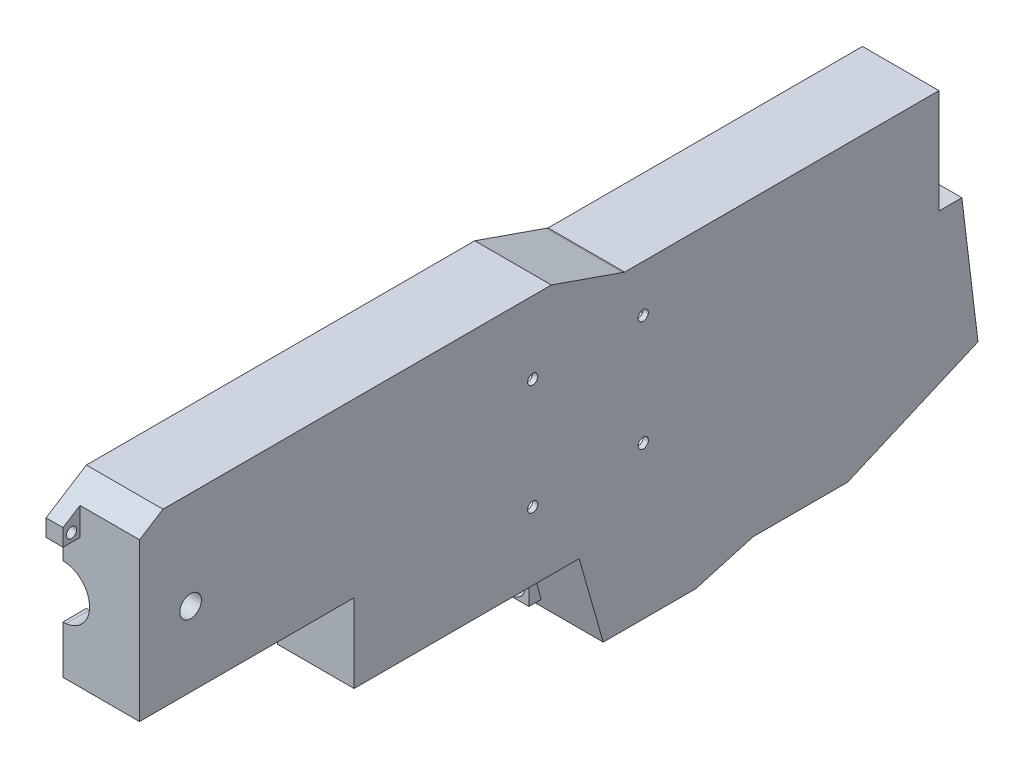
from build123d import *

# Parameters (mm, degrees)
SKETCH_1_W                   = 200
SKETCH_1_H                   = 65
SKETCH_1_R                   = 2.55
SKETCH_1_R_2                 = 2.2
EXTRUDE_1_DEPTH              = 2
SKETCH_2_W                   = 200
SKETCH_2_H                   = 2
EXTRUDE_2_DEPTH              = 16
SKETCH_3_R                   = 2.55
EXTRUDE_3_DEPTH              = 2.6
SKETCH_4_R                   = 4
SKETCH_4_R_2                 = 2.55
EXTRUDE_4_DEPTH              = 4.5
SKETCH_5_R                   = 2.2
EXTRUDE_5_DEPTH              = 16
SKETCH_6_R                   = 3.75
EXTRUDE_6_DEPTH              = 8.2
SKETCH_7_W                   = 200
SKETCH_7_H                   = 2
EXTRUDE_7_DEPTH              = 2
SKETCH_8_W                   = 165.45
SKETCH_8_H                   = 1.65
EXTRUDE_8_DEPTH              = 1.5
EXTRUDE_10_REACH             = 108.629
SKETCH_9_W                   = 5.5
SKETCH_9_H                   = 4
SKETCH_9_H_2                 = 4.5
SKETCH_9_H_3                 = 2
EXTRUDE_10_DIRECTION_2_REACH = 108.629
SKETCH_10_W                  = 5.5
SKETCH_10_H                  = 6.2
CUT_EXTRUDE_1_DEPTH          = 6.24
EXTRUDE_11_DEPTH             = 5.5
CUT_EXTRUDE_2_DEPTH          = 107.987148761
SKETCH_13_W                  = 2
SKETCH_13_H                  = 19
EXTRUDE_12_DEPTH             = 16
SKETCH_15_W                  = 11
SKETCH_15_H                  = 2
CUT_EXTRUDE_3_DEPTH          = 6.3
SKETCH_16_W                  = 7
SKETCH_16_H                  = 2
CUT_EXTRUDE_4_DEPTH          = 14
EXTRUDE_13_DEPTH             = 2
SKETCH_18_W                  = 14
SKETCH_18_H                  = 2
CUT_EXTRUDE_5_DEPTH          = 16
CUT_EXTRUDE_6_DEPTH          = 2
EXTRUDE_START                = -18
SKETCH_20_R                  = 25.5
SKETCH_20_R_2                = 22.7
EXTRUDE_14_DEPTH             = 24
SKETCH_21_W                  = 13
SKETCH_21_H                  = 4.7
EXTRUDE_15_DEPTH             = 2
SKETCH_22_R                  = 1.25
CUT_EXTRUDE_7_DEPTH          = 2
EXTRUDE_START_2              = 2
SKETCH_23_R                  = 22.7
SKETCH_23_R_2                = 1.25
EXTRUDE_17_DEPTH             = 2
CUT_EXTRUDE_START            = -16
CUT_EXTRUDE_10_DEPTH         = 16
CUT_EXTRUDE_START_2          = -17
CUT_EXTRUDE_10_2_OUTLINE_R   = 2.45
CUT_EXTRUDE_10_2_OUTLINE_R_2 = 1.25
CUT_EXTRUDE_10_2_DEPTH       = 1
EXTRUDE_START_3              = -1.5
EXTRUDE_18_DEPTH             = 1.5
SKETCH_28_W                  = 4
SKETCH_28_H                  = 4
SKETCH_28_R                  = 1.2
EXTRUDE_20_DEPTH             = 4
SKETCH_29_W                  = 4
SKETCH_29_H                  = 4
SKETCH_29_R                  = 1.2
EXTRUDE_21_DEPTH             = 4
EXTRUDE_22_DEPTH             = 4
SKETCH_31_W                  = 4
SKETCH_31_H                  = 4
SKETCH_31_R                  = 1.2
EXTRUDE_23_DEPTH             = 4
CUT_EXTRUDE_START_3          = -6
SKETCH_32_R                  = 25.5
CUT_EXTRUDE_11_DEPTH         = 6
CUT_EXTRUDE_12_DEPTH         = 16
SKETCH_35_W                  = 5.5
SKETCH_35_H                  = 3
SKETCH_35_W_2                = 2
SKETCH_35_H_2                = 2
EXTRUDE_26_DEPTH             = 16
EXTRUDE_START_4              = -2
EXTRUDE_30_DEPTH             = 2
SKETCH_38_W                  = 16
SKETCH_38_H                  = 5.5
EXTRUDE_31_DEPTH             = 6.3
CUT_EXTRUDE_START_4          = 5
CUT_EXTRUDE_13_DEPTH         = 5
CUT_EXTRUDE_START_5          = -5
CUT_EXTRUDE_14_DEPTH         = 5
CUT_EXTRUDE_15_DEPTH         = 9.7
SKETCH_42_W                  = 14
SKETCH_42_H                  = 2
CUT_EXTRUDE_17_DEPTH         = 12
EXTRUDE_35_DEPTH             = 18
EXTRUDE_36_DEPTH             = 2
CUT_EXTRUDE_18_DEPTH         = 2
EXTRUDE_37_REACH             = 114.296
SKETCH_47_W                  = 91.33315603
SKETCH_47_H                  = 4
EXTRUDE_38_DEPTH             = 2
SKETCH_48_W                  = 91.33315603
SKETCH_48_H                  = 2
CUT_EXTRUDE_19_DEPTH         = 16
CUT_EXTRUDE_20_DEPTH         = 14
CUT_EXTRUDE_21_DEPTH         = 16
SKETCH_51_R                  = 3.75
SKETCH_51_R_2                = 2.2
EXTRUDE_39_DEPTH             = 8.2
SKETCH_53_R                  = 2.1
EXTRUDE_40_DEPTH             = 7.8
SKETCH_54_R                  = 3.75
CUT_EXTRUDE_23_DEPTH         = 16
SKETCH_55_R                  = 2.2
EXTRUDE_42_DEPTH             = 2
EXTRUDE_43_DEPTH             = 4
SKETCH_57_W                  = 9
SKETCH_57_H                  = 2
EXTRUDE_44_DEPTH             = 12
SKETCH_58_W                  = 6
SKETCH_58_H                  = 2
CUT_EXTRUDE_24_DEPTH         = 12
CUT_EXTRUDE_START_6          = -4.5
SKETCH_59_R                  = 4
CUT_EXTRUDE_25_DEPTH         = 4.5
CUT_EXTRUDE_26_REACH         = 115.05
SKETCH_60_W                  = 12
SKETCH_60_H                  = 24.5
SKETCH_60_W_2                = 4
SKETCH_60_H_2                = 4
SKETCH_60_R                  = 1.2
SKETCH_61_W                  = 2
SKETCH_61_H                  = 28
CUT_EXTRUDE_27_DEPTH         = 114.049767802
EXTRUDE_45_DEPTH             = 18
CUT_EXTRUDE_28_DEPTH         = 10
SKETCH_64_R                  = 1.2
EXTRUDE_46_DEPTH             = 4
SKETCH_65_W                  = 5
SKETCH_65_H                  = 6.638569711
EXTRUDE_47_DEPTH             = 4
CUT_EXTRUDE_29_DEPTH         = 10
EXTRUDE_48_DEPTH             = 12
EXTRUDE_49_DEPTH             = 1.5
SKETCH_70_R                  = 2.45
EXTRUDE_50_DEPTH             = 2
EXTRUDE_51_DEPTH             = 5.1
EXTRUDE_START_5              = -4
EXTRUDE_51_2_OUTLINE_R       = 3.2
EXTRUDE_51_2_DEPTH           = 2.8
EXTRUDE_START_6              = -1.2
EXTRUDE_51_3_OUTLINE_R       = 1.2
EXTRUDE_51_3_DEPTH           = 2.2


with BuildPart() as part:
    # 草图1 → 凸台-拉伸1 (new body)
    with BuildSketch(Plane(origin=(0, 0, 0), x_dir=(0, 0, -1), z_dir=(1, 0, 0))):
        Rectangle(SKETCH_1_W, SKETCH_1_H)
        with Locations((-88, 17.5)):
            Circle(SKETCH_1_R, mode=Mode.SUBTRACT)
        with Locations((61.45, -15.22)):
            Circle(SKETCH_1_R_2, mode=Mode.SUBTRACT)
    extrude(amount=EXTRUDE_1_DEPTH)

    # 草图3 → 凸台-拉伸3 (add)
    with BuildSketch(Plane(origin=(2, 0, 0), x_dir=(0, 0, -1), z_dir=(1, 0, 0))):
        Polygon((-65.45, 13.5), (-65.45, 17.5), (-65.45, 21.5), (-100, 21.5), (-100, 13.5), align=None)
        with Locations((-88, 17.5)):
            Circle(SKETCH_3_R, mode=Mode.SUBTRACT)
    extrude(amount=EXTRUDE_3_DEPTH)

    # 草图4 → 凸台-拉伸4 (add)
    with BuildSketch(Plane(origin=(4.6, 0, 0), x_dir=(0, 0, -1), z_dir=(1, 0, 0))):
        with Locations(Location((-88, 17.5, 0), (0, 0, 270))):
            Circle(SKETCH_4_R)
        with Locations((-88, 17.5)):
            Circle(SKETCH_4_R_2, mode=Mode.SUBTRACT)
    extrude(amount=EXTRUDE_4_DEPTH)



with BuildPart() as body_2:
    # 草图2 → 凸台-拉伸2 (new body)
    with BuildSketch(Plane(origin=(2, 0, 0), x_dir=(0, 0, -1), z_dir=(1, 0, 0))):
        with Locations((0, 33.5)):
            Rectangle(SKETCH_2_W, SKETCH_2_H)
    extrude(amount=EXTRUDE_2_DEPTH)


with BuildPart() as body_3:
    # 草图5 → 凸台-拉伸5 (new body)
    with BuildSketch(Plane(origin=(2, 0, 0), x_dir=(0, 0, -1), z_dir=(1, 0, 0))):
        with Locations((61.45, -15.22)):
            Circle(SKETCH_5_R)
    extrude(amount=EXTRUDE_5_DEPTH)


with BuildPart() as part_1:
    add(part.part)

    add(body_3.part)  # 凸台-拉伸6 merges body 3
    # 草图6 → 凸台-拉伸6 (add)
    with BuildSketch(Plane(origin=(2, 0, 0), x_dir=(0, 0, -1), z_dir=(1, 0, 0))):
        with Locations((61.45, -15.22)):
            Circle(SKETCH_6_R)
    extrude(amount=EXTRUDE_6_DEPTH)


    add(body_2.part)  # 凸台-拉伸7 merges body 2
    # 草图7 → 凸台-拉伸7 (add)
    with BuildSketch(Plane.ZY.offset(-2)):
        with Locations((0, 33.5)):
            Rectangle(SKETCH_7_W, SKETCH_7_H)
    extrude(amount=EXTRUDE_7_DEPTH)

    # 草图8 → 凸台-拉伸8 (add)
    with BuildSketch(Plane(origin=(2, 0, 0), x_dir=(0, 0, -1), z_dir=(1, 0, 0))):
        with Locations((17.275, 20.675)):
            Rectangle(SKETCH_8_W, SKETCH_8_H)
        with Locations((17.275, 14.325)):
            Rectangle(SKETCH_8_W, SKETCH_8_H)
    extrude(amount=EXTRUDE_8_DEPTH)

    # 凸台-拉伸10: up to this face of the body (flat: up to its plane)
    extrude_10_end = Plane(part_1.part.faces().sort_by_distance((18, 33.5, 0))[0])
    # 草图9 → 凸台-拉伸10 (add, up to the picked face)
    with BuildSketch(Plane(origin=(4.6, 0, 0), x_dir=(0, 0, -1), z_dir=(1, 0, 0)), mode=Mode.PRIVATE) as extrude_10_sk1:
        Polygon((-100, 21.5), (-94.5, 21.5), (-94.5, 32.5), (-100, 32.5), (-100, 28), align=None)
    extrude_10_tool1 = split(extrude(extrude_10_sk1.sketch, amount=EXTRUDE_10_REACH, mode=Mode.PRIVATE), bisect_by=extrude_10_end, keep=Keep.BOTH, mode=Mode.PRIVATE)
    # 草图9 → 凸台-拉伸10 (add, up to the picked face)
    with BuildSketch(Plane(origin=(4.6, 0, 0), x_dir=(0, 0, -1), z_dir=(1, 0, 0)), mode=Mode.PRIVATE) as extrude_10_sk2:
        with Locations((-97.25, 19.5)):
            Rectangle(SKETCH_9_W, SKETCH_9_H)
    extrude_10_tool2 = split(extrude(extrude_10_sk2.sketch, amount=EXTRUDE_10_REACH, mode=Mode.PRIVATE), bisect_by=extrude_10_end, keep=Keep.BOTH, mode=Mode.PRIVATE)
    # 草图9 → 凸台-拉伸10 (add, up to the picked face)
    with BuildSketch(Plane(origin=(4.6, 0, 0), x_dir=(0, 0, -1), z_dir=(1, 0, 0)), mode=Mode.PRIVATE) as extrude_10_sk3:
        with Locations((-97.25, 15.5)):
            Rectangle(SKETCH_9_W, SKETCH_9_H)
    extrude_10_tool3 = split(extrude(extrude_10_sk3.sketch, amount=EXTRUDE_10_REACH, mode=Mode.PRIVATE), bisect_by=extrude_10_end, keep=Keep.BOTH, mode=Mode.PRIVATE)
    # 草图9 → 凸台-拉伸10 (add, up to the picked face)
    with BuildSketch(Plane(origin=(4.6, 0, 0), x_dir=(0, 0, -1), z_dir=(1, 0, 0)), mode=Mode.PRIVATE) as extrude_10_sk4:
        with Locations((-97.25, 9.25)):
            Rectangle(SKETCH_9_W, SKETCH_9_H_2)
    extrude_10_tool4 = split(extrude(extrude_10_sk4.sketch, amount=EXTRUDE_10_REACH, mode=Mode.PRIVATE), bisect_by=extrude_10_end, keep=Keep.BOTH, mode=Mode.PRIVATE)
    # 草图9 → 凸台-拉伸10 (add, up to the picked face)
    with BuildSketch(Plane(origin=(4.6, 0, 0), x_dir=(0, 0, -1), z_dir=(1, 0, 0)), mode=Mode.PRIVATE) as extrude_10_sk5:
        with Locations((-97.25, 12.5)):
            Rectangle(SKETCH_9_W, SKETCH_9_H_3)
    extrude_10_tool5 = split(extrude(extrude_10_sk5.sketch, amount=EXTRUDE_10_REACH, mode=Mode.PRIVATE), bisect_by=extrude_10_end, keep=Keep.BOTH, mode=Mode.PRIVATE)
    add(extrude_10_tool1.solids().sort_by(Axis((4.6, 27, 97.25), (1, 0, 0)))[0])
    add(extrude_10_tool2.solids().sort_by(Axis((4.6, 19.5, 97.25), (1, 0, 0)))[0])
    add(extrude_10_tool3.solids().sort_by(Axis((4.6, 15.5, 97.25), (1, 0, 0)))[0])
    add(extrude_10_tool4.solids().sort_by(Axis((4.6, 9.25, 97.25), (1, 0, 0)))[0])
    add(extrude_10_tool5.solids().sort_by(Axis((4.6, 12.5, 97.25), (1, 0, 0)))[0])

    # 凸台-拉伸10 direction 2: up to this face of the body (flat: up to its plane)
    extrude_10_direction_2_end = Plane(part_1.part.faces().sort_by_distance((2, -9.47239987, 0.296508389))[0])
    # 草图9 → 凸台-拉伸10 direction 2 (add, up to the picked face)
    with BuildSketch(Plane(origin=(4.6, 0, 0), x_dir=(0, 0, -1), z_dir=(1, 0, 0)), mode=Mode.PRIVATE) as extrude_10_direction_2_sk1:
        Polygon((-100, 21.5), (-94.5, 21.5), (-94.5, 32.5), (-100, 32.5), (-100, 28), align=None)
    extrude_10_direction_2_tool1 = split(extrude(extrude_10_direction_2_sk1.sketch, amount=-EXTRUDE_10_DIRECTION_2_REACH, mode=Mode.PRIVATE), bisect_by=extrude_10_direction_2_end, keep=Keep.BOTH, mode=Mode.PRIVATE)
    # 草图9 → 凸台-拉伸10 direction 2 (add, up to the picked face)
    with BuildSketch(Plane(origin=(4.6, 0, 0), x_dir=(0, 0, -1), z_dir=(1, 0, 0)), mode=Mode.PRIVATE) as extrude_10_direction_2_sk2:
        with Locations((-97.25, 19.5)):
            Rectangle(SKETCH_9_W, SKETCH_9_H)
    extrude_10_direction_2_tool2 = split(extrude(extrude_10_direction_2_sk2.sketch, amount=-EXTRUDE_10_DIRECTION_2_REACH, mode=Mode.PRIVATE), bisect_by=extrude_10_direction_2_end, keep=Keep.BOTH, mode=Mode.PRIVATE)
    # 草图9 → 凸台-拉伸10 direction 2 (add, up to the picked face)
    with BuildSketch(Plane(origin=(4.6, 0, 0), x_dir=(0, 0, -1), z_dir=(1, 0, 0)), mode=Mode.PRIVATE) as extrude_10_direction_2_sk3:
        with Locations((-97.25, 15.5)):
            Rectangle(SKETCH_9_W, SKETCH_9_H)
    extrude_10_direction_2_tool3 = split(extrude(extrude_10_direction_2_sk3.sketch, amount=-EXTRUDE_10_DIRECTION_2_REACH, mode=Mode.PRIVATE), bisect_by=extrude_10_direction_2_end, keep=Keep.BOTH, mode=Mode.PRIVATE)
    # 草图9 → 凸台-拉伸10 direction 2 (add, up to the picked face)
    with BuildSketch(Plane(origin=(4.6, 0, 0), x_dir=(0, 0, -1), z_dir=(1, 0, 0)), mode=Mode.PRIVATE) as extrude_10_direction_2_sk4:
        with Locations((-97.25, 9.25)):
            Rectangle(SKETCH_9_W, SKETCH_9_H_2)
    extrude_10_direction_2_tool4 = split(extrude(extrude_10_direction_2_sk4.sketch, amount=-EXTRUDE_10_DIRECTION_2_REACH, mode=Mode.PRIVATE), bisect_by=extrude_10_direction_2_end, keep=Keep.BOTH, mode=Mode.PRIVATE)
    # 草图9 → 凸台-拉伸10 direction 2 (add, up to the picked face)
    with BuildSketch(Plane(origin=(4.6, 0, 0), x_dir=(0, 0, -1), z_dir=(1, 0, 0)), mode=Mode.PRIVATE) as extrude_10_direction_2_sk5:
        with Locations((-97.25, 12.5)):
            Rectangle(SKETCH_9_W, SKETCH_9_H_3)
    extrude_10_direction_2_tool5 = split(extrude(extrude_10_direction_2_sk5.sketch, amount=-EXTRUDE_10_DIRECTION_2_REACH, mode=Mode.PRIVATE), bisect_by=extrude_10_direction_2_end, keep=Keep.BOTH, mode=Mode.PRIVATE)
    add(extrude_10_direction_2_tool1.solids().sort_by(Axis((4.6, 27, 97.25), (-1, 0, 0)))[0])
    add(extrude_10_direction_2_tool2.solids().sort_by(Axis((4.6, 19.5, 97.25), (-1, 0, 0)))[0])
    add(extrude_10_direction_2_tool3.solids().sort_by(Axis((4.6, 15.5, 97.25), (-1, 0, 0)))[0])
    add(extrude_10_direction_2_tool4.solids().sort_by(Axis((4.6, 9.25, 97.25), (-1, 0, 0)))[0])
    add(extrude_10_direction_2_tool5.solids().sort_by(Axis((4.6, 12.5, 97.25), (-1, 0, 0)))[0])

    # 草图10 → 切除-拉伸1 (cut)
    with BuildSketch(Plane(origin=(18, 0, 0), x_dir=(0, 0, -1), z_dir=(1, 0, 0))):
        with Locations((-97.25, 20.6)):
            Rectangle(SKETCH_10_W, SKETCH_10_H)
        with Locations((-97.25, 14.4)):
            Rectangle(SKETCH_10_W, SKETCH_10_H)
    extrude(amount=-CUT_EXTRUDE_1_DEPTH, mode=Mode.SUBTRACT)

    # 草图11 → 凸台-拉伸11 (add)
    with BuildSketch(Plane.XY.offset(100)):
        with BuildLine():
            ThreePointArc((11.76, 17.5), (13.344930508, 21.655469652), (17.294592316, 23.7))
            Line((17.294592316, 23.7), (11.76, 23.7))
            Line((11.76, 23.7), (11.76, 17.5))
        make_face()
        with BuildLine():
            Line((11.76, 11.3), (17.294592316, 11.3))
            ThreePointArc((17.294592316, 11.3), (13.344930508, 13.344530348), (11.76, 17.5))
            Line((11.76, 17.5), (11.76, 11.3))
        make_face()
    extrude(amount=-EXTRUDE_11_DEPTH)

    # 草图12 → 切除-拉伸2 (cut, through all)
    with BuildSketch(Plane(origin=(2, 0, 0), x_dir=(0, 0, -1), z_dir=(1, 0, 0))):
        Polygon((-100, -32.5), (5.45, -32.5), (5.45, -15.22), (5.45, -13.5), (-44.55, -13.5), (-44.55, 5), (-94.5, 5), (-100, 5), align=None)
    extrude(amount=-CUT_EXTRUDE_2_DEPTH, mode=Mode.SUBTRACT)

    # 草图13 → 凸台-拉伸12 (add)
    with BuildSketch(Plane(origin=(2, 0, 0), x_dir=(0, 0, -1), z_dir=(1, 0, 0))):
        Polygon((-42.55, 7), (-92.5, 7), (-94.5, 7), (-100, 7), (-100, 5), (-44.55, 5), (-44.55, -13.5), (5.45, -13.5), (5.45, -32.5), (100, -32.5), (100, 13.5), (98, 13.5), (98, 11.5), (98, -30.5), (7.45, -30.5), (7.45, -11.5), (-42.55, -11.5), align=None)
        with Locations((99, 23)):
            Rectangle(SKETCH_13_W, SKETCH_13_H)
    extrude(amount=EXTRUDE_12_DEPTH)

    # 草图15 → 切除-拉伸3 (cut)
    with BuildSketch(Plane(origin=(18, 0, 0), x_dir=(0, 0, -1), z_dir=(1, 0, 0))):
        with Locations((-12.05, -12.5)):
            Rectangle(SKETCH_15_W, SKETCH_15_H)
    extrude(amount=-CUT_EXTRUDE_3_DEPTH, mode=Mode.SUBTRACT)

    # 草图16 → 切除-拉伸4 (cut)
    with BuildSketch(Plane(origin=(18, 0, 0), x_dir=(0, 0, -1), z_dir=(1, 0, 0))):
        with Locations((-78.5, 6)):
            Rectangle(SKETCH_16_W, SKETCH_16_H)
        with Locations((-71.5, 6)):
            Rectangle(SKETCH_16_W, SKETCH_16_H)
    extrude(amount=-CUT_EXTRUDE_4_DEPTH, mode=Mode.SUBTRACT)

    # 草图17 → 凸台-拉伸13 (add)
    with BuildSketch(Plane.XZ.offset(-5)):
        with BuildLine():
            ThreePointArc((18, 68), (11, 75), (18, 82))
            Line((18, 82), (4, 82))
            Line((4, 82), (4, 68))
            Line((4, 68), (18, 68))
        make_face()
    extrude(amount=-EXTRUDE_13_DEPTH)

    # 草图18 → 切除-拉伸5 (cut)
    with BuildSketch(Plane(origin=(18, 0, 0), x_dir=(0, 0, -1), z_dir=(1, 0, 0))):
        with Locations((91, -31.5)):
            Rectangle(SKETCH_18_W, SKETCH_18_H)
    extrude(amount=-CUT_EXTRUDE_5_DEPTH, mode=Mode.SUBTRACT)

    # 草图19 → 切除-拉伸6 (cut)
    with BuildSketch(Plane(origin=(2, 0, 0), x_dir=(0, 0, -1), z_dir=(1, 0, 0))):
        Polygon((-2.8, 19.85), (-2.8, 17.5), (-2.8, 15.15), (10.2, 15.15), (10.2, 19.85), align=None)
    extrude(amount=-CUT_EXTRUDE_6_DEPTH, mode=Mode.SUBTRACT)

    # 草图20 → 凸台-拉伸14 (add)
    with BuildSketch(Plane.ZY.offset(EXTRUDE_START)):
        with Locations((-5.45, 10.5)):
            Circle(SKETCH_20_R)
        with Locations((-5.45, 10.5)):
            Circle(SKETCH_20_R_2, mode=Mode.SUBTRACT)
    extrude(amount=EXTRUDE_14_DEPTH)

    # 草图21 → 凸台-拉伸15 (add)
    with BuildSketch(Plane.ZY):
        with Locations((-3.7, 17.5)):
            Rectangle(SKETCH_21_W, SKETCH_21_H)
    extrude(amount=-EXTRUDE_15_DEPTH)

    # 草图22 → 切除-拉伸7 (cut)
    with BuildSketch(Plane.ZY):
        with Locations((-5.45, 3)):
            Circle(SKETCH_22_R)
        with Locations((-12.167514421, 3.782485579)):
            Circle(SKETCH_22_R)
        with Locations((-12.95, 10.5)):
            Circle(SKETCH_22_R)
        with Locations((-12.167514421, 17.217514421)):
            Circle(SKETCH_22_R)
        with Locations((-5.45, 18)):
            Circle(SKETCH_22_R)
        with Locations((1.267514421, 17.217514421)):
            Circle(SKETCH_22_R)
        with Locations((2.05, 10.5)):
            Circle(SKETCH_22_R)
        with Locations((1.267514421, 3.782485579)):
            Circle(SKETCH_22_R)
    extrude(amount=-CUT_EXTRUDE_7_DEPTH, mode=Mode.SUBTRACT)

    # 草图23 → 凸台-拉伸17 (add)
    with BuildSketch(Plane.ZY.offset(EXTRUDE_START_2)):
        with Locations((-5.45, 10.5)):
            Circle(SKETCH_23_R)
        with Locations((1.267514421, 3.782485579)):
            Circle(SKETCH_23_R_2, mode=Mode.SUBTRACT)
        with Locations((2.05, 10.5)):
            Circle(SKETCH_23_R_2, mode=Mode.SUBTRACT)
        with Locations((1.267514421, 17.217514421)):
            Circle(SKETCH_23_R_2, mode=Mode.SUBTRACT)
        with Locations((-5.45, 18)):
            Circle(SKETCH_23_R_2, mode=Mode.SUBTRACT)
        with Locations((-12.167514421, 17.217514421)):
            Circle(SKETCH_23_R_2, mode=Mode.SUBTRACT)
        with Locations((-12.95, 10.5)):
            Circle(SKETCH_23_R_2, mode=Mode.SUBTRACT)
        with Locations((-12.167514421, 3.782485579)):
            Circle(SKETCH_23_R_2, mode=Mode.SUBTRACT)
        with Locations((-5.45, 3)):
            Circle(SKETCH_23_R_2, mode=Mode.SUBTRACT)
    extrude(amount=-EXTRUDE_17_DEPTH)

    # 切除-拉伸10: read off the stored shape, not the designer's step
    # 切除-拉伸10 outline → 切除-拉伸10 (cut)
    with BuildSketch(Plane(origin=(18, 0, 0), x_dir=(0, 0, -1), z_dir=(1, 0, 0)).offset(CUT_EXTRUDE_START)):
        with BuildLine():
            Line((7.45, -12.111722623), (7.45, -14.921447638))
            ThreePointArc((7.45, -14.921447638), (25.162434806, -5.676214453), (30.772914524, 13.5))
            ThreePointArc((30.772914524, 13.5), (30.66118187, 14.327049613), (30.522445034, 15.15))
            ThreePointArc((30.522445034, 15.15), (29.961128378, 17.532395439), (29.173985752, 19.85))
            ThreePointArc((29.173985752, 19.85), (28.829270645, 20.681340978), (28.455434141, 21.5))
            ThreePointArc((28.455434141, 21.5), (24.22335075, 27.757210134), (18.343796958, 32.5))
            Line((18.343796958, 32.5), (11.043746508, 32.5))
            ThreePointArc((11.043746508, 32.5), (19.312964197, 28.475211367), (25.306736892, 21.5))
            ThreePointArc((25.306736892, 21.5), (25.737628923, 20.683423426), (26.134958303, 19.85))
            ThreePointArc((26.134958303, 19.85), (27.030128894, 17.54187737), (27.66862957, 15.15))
            ThreePointArc((27.66862957, 15.15), (27.824973909, 14.327602719), (27.950888871, 13.5))
            ThreePointArc((27.950888871, 13.5), (23.171836045, -3.685433627), (7.45, -12.111722623))
        make_face()
        with BuildLine():
            Line((-7.443796958, -11.5), (-0.143746508, -11.5))
            ThreePointArc((-0.143746508, -11.5), (-13.353646834, -2.216637359), (-17.050888871, 13.5))
            ThreePointArc((-17.050888871, 13.5), (-16.924973909, 14.327602719), (-16.768629571, 15.15))
            ThreePointArc((-16.768629571, 15.15), (-16.130128895, 17.54187737), (-15.234958303, 19.85))
            ThreePointArc((-15.234958303, 19.85), (-14.837628923, 20.683423426), (-14.406736892, 21.5))
            ThreePointArc((-14.406736892, 21.5), (-8.412964197, 28.475211367), (-0.143746508, 32.5))
            Line((-0.143746508, 32.5), (-7.443796958, 32.5))
            ThreePointArc((-7.443796958, 32.5), (-13.32335075, 27.757210134), (-17.555434141, 21.5))
            ThreePointArc((-17.555434141, 21.5), (-17.929270645, 20.681340978), (-18.273985753, 19.85))
            ThreePointArc((-18.273985753, 19.85), (-19.061128378, 17.532395439), (-19.622445034, 15.15))
            ThreePointArc((-19.622445034, 15.15), (-19.76118187, 14.327049613), (-19.872914524, 13.5))
            ThreePointArc((-19.872914524, 13.5), (-17.383730732, -0.852124949), (-7.443796958, -11.5))
        make_face()
        with BuildLine():
            ThreePointArc((10.853024361, 15.15), (12.167514421, 14.767514421), (13.482004481, 15.15))
            Line((13.482004481, 15.15), (10.853024361, 15.15))
        make_face()
        with BuildLine():
            Line((0.046975639, 15.15), (-2.582004481, 15.15))
            ThreePointArc((-2.582004481, 15.15), (-1.267514421, 14.767514421), (0.046975639, 15.15))
        make_face()
        with BuildLine():
            Line((3.84376216, 19.85), (7.05623784, 19.85))
            ThreePointArc((7.05623784, 19.85), (5.45, 20.45), (3.84376216, 19.85))
        make_face()
    extrude(amount=CUT_EXTRUDE_10_DEPTH, mode=Mode.SUBTRACT)

    # Cut-Extrude 10 2 outline → Cut-Extrude 10 2 (cut)
    # profile 1 of 8: a face of its own
    with BuildSketch(Plane(origin=(18, 0, 0), x_dir=(0, 0, -1), z_dir=(1, 0, 0)).offset(CUT_EXTRUDE_START_2)):
        with Locations((12.167514421, 17.217514421)):
            Circle(CUT_EXTRUDE_10_2_OUTLINE_R)
        with Locations((12.167514421, 17.217514421)):
            Circle(CUT_EXTRUDE_10_2_OUTLINE_R_2, mode=Mode.SUBTRACT)
    # profile 2 of 8: a face of its own
    with BuildSketch(Plane(origin=(18, 0, 0), x_dir=(0, 0, -1), z_dir=(1, 0, 0)).offset(CUT_EXTRUDE_START_2)):
        with Locations((-1.267514421, 17.217514421)):
            Circle(CUT_EXTRUDE_10_2_OUTLINE_R)
        with Locations((-1.267514421, 17.217514421)):
            Circle(CUT_EXTRUDE_10_2_OUTLINE_R_2, mode=Mode.SUBTRACT)
    # profile 3 of 8: a face of its own
    with BuildSketch(Plane(origin=(18, 0, 0), x_dir=(0, 0, -1), z_dir=(1, 0, 0)).offset(CUT_EXTRUDE_START_2)):
        with Locations((5.45, 18)):
            Circle(CUT_EXTRUDE_10_2_OUTLINE_R)
        with Locations((5.45, 18)):
            Circle(CUT_EXTRUDE_10_2_OUTLINE_R_2, mode=Mode.SUBTRACT)
    # profile 4 of 8: a face of its own
    with BuildSketch(Plane(origin=(18, 0, 0), x_dir=(0, 0, -1), z_dir=(1, 0, 0)).offset(CUT_EXTRUDE_START_2)):
        with Locations((-1.267514421, 3.782485579)):
            Circle(CUT_EXTRUDE_10_2_OUTLINE_R)
        with Locations((-1.267514421, 3.782485579)):
            Circle(CUT_EXTRUDE_10_2_OUTLINE_R_2, mode=Mode.SUBTRACT)
    # profile 5 of 8: a face of its own
    with BuildSketch(Plane(origin=(18, 0, 0), x_dir=(0, 0, -1), z_dir=(1, 0, 0)).offset(CUT_EXTRUDE_START_2)):
        with Locations((-2.05, 10.5)):
            Circle(CUT_EXTRUDE_10_2_OUTLINE_R)
        with Locations((-2.05, 10.5)):
            Circle(CUT_EXTRUDE_10_2_OUTLINE_R_2, mode=Mode.SUBTRACT)
    # profile 6 of 8: a face of its own
    with BuildSketch(Plane(origin=(18, 0, 0), x_dir=(0, 0, -1), z_dir=(1, 0, 0)).offset(CUT_EXTRUDE_START_2)):
        with Locations((12.95, 10.5)):
            Circle(CUT_EXTRUDE_10_2_OUTLINE_R)
        with Locations((12.95, 10.5)):
            Circle(CUT_EXTRUDE_10_2_OUTLINE_R_2, mode=Mode.SUBTRACT)
    # profile 7 of 8: a face of its own
    with BuildSketch(Plane(origin=(18, 0, 0), x_dir=(0, 0, -1), z_dir=(1, 0, 0)).offset(CUT_EXTRUDE_START_2)):
        with Locations((12.167514421, 3.782485579)):
            Circle(CUT_EXTRUDE_10_2_OUTLINE_R)
        with Locations((12.167514421, 3.782485579)):
            Circle(CUT_EXTRUDE_10_2_OUTLINE_R_2, mode=Mode.SUBTRACT)
    # profile 8 of 8: a face of its own
    with BuildSketch(Plane(origin=(18, 0, 0), x_dir=(0, 0, -1), z_dir=(1, 0, 0)).offset(CUT_EXTRUDE_START_2)):
        with Locations((5.45, 3)):
            Circle(CUT_EXTRUDE_10_2_OUTLINE_R)
        with Locations((5.45, 3)):
            Circle(CUT_EXTRUDE_10_2_OUTLINE_R_2, mode=Mode.SUBTRACT)
    extrude(amount=CUT_EXTRUDE_10_2_DEPTH, mode=Mode.SUBTRACT)

    # 草图26 → 凸台-拉伸18 (add)
    with BuildSketch(Plane(origin=(3.5, 0, 0), x_dir=(0, 0, -1), z_dir=(1, 0, 0)).offset(EXTRUDE_START_3)):
        with BuildLine():
            ThreePointArc((-14.406736892, 21.5), (-14.837628923, 20.683423426), (-15.234958303, 19.85))
            Line((-15.234958303, 19.85), (-18.273985753, 19.85))
            ThreePointArc((-18.273985753, 19.85), (-17.929270645, 20.681340978), (-17.555434141, 21.5))
            Line((-17.555434141, 21.5), (-14.406736892, 21.5))
        make_face()
        with BuildLine():
            ThreePointArc((-16.768629571, 15.15), (-16.924973909, 14.327602719), (-17.050888871, 13.5))
            Line((-17.050888871, 13.5), (-19.872914524, 13.5))
            ThreePointArc((-19.872914524, 13.5), (-19.76118187, 14.327049613), (-19.622445034, 15.15))
            Line((-19.622445034, 15.15), (-16.768629571, 15.15))
        make_face()
        with BuildLine():
            ThreePointArc((26.134958303, 19.85), (25.737628923, 20.683423426), (25.306736892, 21.5))
            Line((25.306736892, 21.5), (28.455434141, 21.5))
            ThreePointArc((28.455434141, 21.5), (28.829270645, 20.681340978), (29.173985753, 19.85))
            Line((29.173985753, 19.85), (26.134958303, 19.85))
        make_face()
        with BuildLine():
            Line((30.772914524, 13.5), (27.950888871, 13.5))
            ThreePointArc((27.950888871, 13.5), (27.824973909, 14.327602719), (27.668629571, 15.15))
            Line((27.668629571, 15.15), (30.522445034, 15.15))
            ThreePointArc((30.522445034, 15.15), (30.66118187, 14.327049613), (30.772914524, 13.5))
        make_face()
    extrude(amount=EXTRUDE_18_DEPTH)

    # 草图28 → 凸台-拉伸20 (add)
    with BuildSketch(Plane(origin=(18, 0, 0), x_dir=(0, 0, -1), z_dir=(1, 0, 0))):
        with Locations((102, 32.5)):
            Rectangle(SKETCH_28_W, SKETCH_28_H)
        with Locations((102, 32.5)):
            Circle(SKETCH_28_R, mode=Mode.SUBTRACT)
    extrude(amount=-EXTRUDE_20_DEPTH)

    # 草图29 → 凸台-拉伸21 (add)
    with BuildSketch(Plane(origin=(18, 0, 0), x_dir=(0, 0, -1), z_dir=(1, 0, 0))):
        with Locations((102, -30.5)):
            Rectangle(SKETCH_29_W, SKETCH_29_H)
        with Locations((102, -30.5)):
            Circle(SKETCH_29_R, mode=Mode.SUBTRACT)
    extrude(amount=-EXTRUDE_21_DEPTH)

    # 草图30 → 凸台-拉伸22 (add)
    with BuildSketch(Plane(origin=(18, 0, 0), x_dir=(0, 0, -1), z_dir=(1, 0, 0))):
        with BuildLine():
            Line((2.058047025, -16.447242322), (0.45, -15))
            Line((0.45, -15), (0.45, -19.5))
            Line((0.45, -19.5), (5.45, -19.5))
            Line((5.45, -19.5), (3.841952975, -18.052757678))
            ThreePointArc((3.841952975, -18.052757678), (2.147242322, -18.141952975), (2.058047025, -16.447242322))
        make_face()
        with BuildLine():
            Line((5.45, -15), (0.45, -15))
            Line((0.45, -15), (2.058047025, -16.447242322))
            ThreePointArc((2.058047025, -16.447242322), (3.379916521, -16.129655506), (4.15, -17.25))
            ThreePointArc((4.15, -17.25), (4.070344494, -17.679916521), (3.841952975, -18.052757678))
            Line((3.841952975, -18.052757678), (5.45, -19.5))
            Line((5.45, -19.5), (5.45, -15))
        make_face()
        with BuildLine():
            Line((0.45, -19.5), (0.45, -15))
            Line((0.45, -15), (5.45, -15))
            ThreePointArc((5.45, -15), (1.076786079, -14.622201337), (-3.16684397, -13.5))
            Line((-3.16684397, -13.5), (-3.16684397, -19.5))
            Line((-3.16684397, -19.5), (0.45, -19.5))
        make_face()
    extrude(amount=-EXTRUDE_22_DEPTH)

    # 草图31 → 凸台-拉伸23 (add)
    with BuildSketch(Plane(origin=(18, 0, 0), x_dir=(0, 0, -1), z_dir=(1, 0, 0))):
        with Locations((-102, 32.5)):
            Rectangle(SKETCH_31_W, SKETCH_31_H)
        with Locations((-102, 32.5)):
            Circle(SKETCH_31_R, mode=Mode.SUBTRACT)
    extrude(amount=-EXTRUDE_23_DEPTH)

    # 草图32 → 切除-拉伸11 (cut)
    with BuildSketch(Plane.ZY.offset(6).offset(CUT_EXTRUDE_START_3)):
        with Locations((-5.45, 10.5)):
            Circle(SKETCH_32_R)
    extrude(amount=CUT_EXTRUDE_11_DEPTH, mode=Mode.SUBTRACT)

    # 草图34 → 切除-拉伸12 (cut)
    with BuildSketch(Plane(origin=(18, 0, 0), x_dir=(0, 0, -1), z_dir=(1, 0, 0))):
        Polygon((-68, 7), (-68, 5), (-44.55, 5), (-44.55, -13.5), (-17.55, -13.5), (-17.55, -11.5), (-42.55, -11.5), (-42.55, 7), align=None)
        Polygon((-100, 5), (-82, 5), (-82, 7), (-94.5, 7), (-94.5, 11.3), (-100, 11.3), align=None)
        with BuildLine():
            Line((-3.16684397, -19.5), (5.45, -19.5))
            Line((5.45, -19.5), (5.45, -32.5))
            Line((5.45, -32.5), (84, -32.5))
            Line((84, -32.5), (84, -30.5))
            Line((84, -30.5), (7.45, -30.5))
            Line((7.45, -30.5), (7.45, -11.5))
            Line((7.45, -11.5), (-7.443796958, -11.5))
            ThreePointArc((-7.443796958, -11.5), (-6.999408892, -11.754487598), (-6.55, -12))
            Line((-6.55, -12), (-6.55, -13.5))
            Line((-6.55, -13.5), (-3.16684397, -13.5))
            Line((-3.16684397, -13.5), (-3.16684397, -19.5))
        make_face()
    extrude(amount=-CUT_EXTRUDE_12_DEPTH, mode=Mode.SUBTRACT)



with BuildPart() as body_2_2:
    # 草图35 → 凸台-拉伸26 (new body)
    with BuildSketch(Plane(origin=(2, 0, 0), x_dir=(0, 0, -1), z_dir=(1, 0, 0))):
        Polygon((-49.55, 2), (-94.5, 2), (-100, 2), (-100, 0), (-49.55, 0), align=None)
        with Locations((-97.25, 3.5)):
            Rectangle(SKETCH_35_W, SKETCH_35_H)
        with Locations((-48.55, 1)):
            Rectangle(SKETCH_35_W_2, SKETCH_35_H_2)
        Polygon((-47.55, 0), (-49.55, 0), (-49.55, -13.5), (-49.55, -18.5), (-44.55, -18.5), (5.45, -18.5), (5.45, -16.5), (-44.55, -16.5), (-47.55, -16.5), (-47.55, -13.5), align=None)
    extrude(amount=EXTRUDE_26_DEPTH)


with BuildPart() as part_2:
    add(part_1.part)

    add(body_2_2.part)  # 凸台-拉伸30 merges body 2 2
    # 草图37 → 凸台-拉伸30 (add)
    with BuildSketch(Plane.ZY.offset(EXTRUDE_START_4)):
        with BuildLine():
            Line((-5.45, -15), (-5.45, -16.5))
            Line((-5.45, -16.5), (47.55, -16.5))
            Line((47.55, -16.5), (47.55, 2))
            Line((47.55, 2), (94.5, 2))
            Line((94.5, 2), (94.5, 5))
            Line((94.5, 5), (44.55, 5))
            Line((44.55, 5), (44.55, -13.5))
            Line((44.55, -13.5), (3.16684397, -13.5))
            ThreePointArc((3.16684397, -13.5), (-1.076786079, -14.622201337), (-5.45, -15))
        make_face()
        Polygon((-5.45, -16.5), (-5.45, -18.5), (49.55, -18.5), (49.55, 0), (100, 0), (100, 5), (94.5, 5), (94.5, 2), (47.55, 2), (47.55, -16.5), align=None)
    extrude(amount=EXTRUDE_30_DEPTH)

    # 草图38 → 凸台-拉伸31 (add)
    with BuildSketch(Plane(origin=(0, 5, 0), x_dir=(1, 0, 0), z_dir=(0, 1, 0))):
        with Locations((10, -97.25)):
            Rectangle(SKETCH_38_W, SKETCH_38_H)
    extrude(amount=EXTRUDE_31_DEPTH)

    # 草图39 → 切除-拉伸13 (cut)
    with BuildSketch(Plane.XZ.offset(-5).offset(CUT_EXTRUDE_START_4)):
        with BuildLine():
            Line((18, 82), (18, 68))
            ThreePointArc((18, 68), (11, 75), (18, 82))
        make_face()
    extrude(amount=-CUT_EXTRUDE_13_DEPTH, mode=Mode.SUBTRACT)

    # 草图40 → 切除-拉伸14 (cut)
    with BuildSketch(Plane(origin=(0, 7, 0), x_dir=(1, 0, 0), z_dir=(0, 1, 0)).offset(CUT_EXTRUDE_START_5)):
        with BuildLine():
            Line((2, -82), (18, -82))
            ThreePointArc((18, -82), (11, -75), (18, -68))
            Line((18, -68), (2, -68))
            Line((2, -68), (2, -82))
        make_face()
    extrude(amount=CUT_EXTRUDE_14_DEPTH, mode=Mode.SUBTRACT)

    # 草图41 → 切除-拉伸15 (cut)
    with BuildSketch(Plane(origin=(11.7, 0, 0), x_dir=(0, 0, -1), z_dir=(1, 0, 0))):
        with BuildLine():
            Line((-7.443796958, -11.5), (-17.55, -11.5))
            Line((-17.55, -11.5), (-17.55, -13.5))
            Line((-17.55, -13.5), (-6.55, -13.5))
            Line((-6.55, -13.5), (-6.55, -12))
            ThreePointArc((-6.55, -12), (-6.999408892, -11.754487598), (-7.443796958, -11.5))
        make_face()
    extrude(amount=-CUT_EXTRUDE_15_DEPTH, mode=Mode.SUBTRACT)

    # 草图42 → 切除-拉伸17 (cut)
    with BuildSketch(Plane(origin=(18, 0, 0), x_dir=(0, 0, -1), z_dir=(1, 0, 0))):
        with Locations((-22.05, -17.5)):
            Rectangle(SKETCH_42_W, SKETCH_42_H)
    extrude(amount=-CUT_EXTRUDE_17_DEPTH, mode=Mode.SUBTRACT)

    # 草图43 → 凸台-拉伸35 (add)
    with BuildSketch(Plane(origin=(2, 0, 0), x_dir=(0, 0, -1), z_dir=(1, 0, 0)).offset(EXTRUDE_START_4)):
        Polygon((5.45, -18.5), (3.369968603, -18.5), (9.040281686, -38.346095791), (30.828994401, -38.346095791), (44.290329668, -34.5), (100, -34.5), (100, -32.5), (44.010219779, -32.5), (30.548884512, -36.346095791), (10.548884512, -36.346095791), align=None)
    extrude(amount=EXTRUDE_35_DEPTH)

    # 草图44 → 凸台-拉伸36 (add)
    with BuildSketch(Plane(origin=(2, 0, 0), x_dir=(0, 0, -1), z_dir=(1, 0, 0))):
        Polygon((44.010219779, -32.5), (9.45, -32.5), (10.548884512, -36.346095791), (30.548884512, -36.346095791), align=None)
    extrude(amount=-EXTRUDE_36_DEPTH)

    # 草图45 → 切除-拉伸18 (cut)
    with BuildSketch(Plane(origin=(2, 0, 0), x_dir=(0, 0, -1), z_dir=(1, 0, 0))):
        Polygon((7.369968603, -32.5), (5.45, -25.780109889), (5.45, -32.5), align=None)
    extrude(amount=-CUT_EXTRUDE_18_DEPTH, mode=Mode.SUBTRACT)

    # 凸台-拉伸37: up to this face of the body (flat: up to its plane)
    extrude_37_end = Plane(part_2.part.faces().sort_by_distance((0, 4.411657354, -13.61181875))[0])
    # 草图46 → 凸台-拉伸37 (add, up to the picked face)
    with BuildSketch(Plane(origin=(18, 0, 0), x_dir=(0, 0, -1), z_dir=(1, 0, 0)), mode=Mode.PRIVATE) as extrude_37_sk1:
        with BuildLine():
            Line((-104, 34.5), (-94.5, 34.5))
            Line((-94.5, 34.5), (-94.5, 38.5))
            Line((-94.5, 38.5), (-3.16684397, 38.5))
            Line((-3.16684397, 38.5), (-3.16684397, 34.5))
            ThreePointArc((-3.16684397, 34.5), (5.203401519, 35.998807603), (13.60106862, 34.662162162))
            Line((13.60106862, 34.662162162), (-3.16684397, 40.5))
            Line((-3.16684397, 40.5), (-94.5, 40.5))
            Line((-94.5, 40.5), (-104, 34.5))
        make_face()
    extrude_37_tool1 = split(extrude(extrude_37_sk1.sketch, amount=-EXTRUDE_37_REACH, mode=Mode.PRIVATE), bisect_by=extrude_37_end, keep=Keep.BOTH, mode=Mode.PRIVATE)
    add(extrude_37_tool1.solids().sort_by(Axis((18, 38.830648, 47.50919), (-1, 0, 0)))[0])

    # 草图47 → 凸台-拉伸38 (add)
    with BuildSketch(Plane.ZY):
        with Locations((48.833421985, 36.5)):
            Rectangle(SKETCH_47_W, SKETCH_47_H)
    extrude(amount=-EXTRUDE_38_DEPTH)

    # 草图48 → 切除-拉伸19 (cut)
    with BuildSketch(Plane(origin=(18, 0, 0), x_dir=(0, 0, -1), z_dir=(1, 0, 0))):
        with Locations((-48.833421985, 33.5)):
            Rectangle(SKETCH_48_W, SKETCH_48_H)
    extrude(amount=-CUT_EXTRUDE_19_DEPTH, mode=Mode.SUBTRACT)

    # 草图49 → 切除-拉伸20 (cut)
    with BuildSketch(Plane.ZY):
        Polygon((100, 37.026315789), (100, 34.5), (104, 34.5), align=None)
    extrude(amount=-CUT_EXTRUDE_20_DEPTH, mode=Mode.SUBTRACT)

    # 草图50 → 切除-拉伸21 (cut)
    with BuildSketch(Plane(origin=(18, 0, 0), x_dir=(0, 0, -1), z_dir=(1, 0, 0))):
        Polygon((14.06684397, 32.5), (-3.16684397, 38.5), (-3.16684397, 32.5), align=None)
    extrude(amount=-CUT_EXTRUDE_21_DEPTH, mode=Mode.SUBTRACT)

    # 草图51 → 凸台-拉伸39 (add)
    # profile 1 of 2: a face of its own
    with BuildSketch(Plane(origin=(2, 0, 0), x_dir=(0, 0, -1), z_dir=(1, 0, 0))):
        with Locations((61.45, -23.22)):
            Circle(SKETCH_51_R)
        with Locations((61.45, -23.22)):
            Circle(SKETCH_51_R_2, mode=Mode.SUBTRACT)
    # profile 2 of 2: a face of its own
    with BuildSketch(Plane(origin=(2, 0, 0), x_dir=(0, 0, -1), z_dir=(1, 0, 0))):
        with Locations((61.45, -23.22)):
            Circle(SKETCH_51_R_2)
    extrude(amount=EXTRUDE_39_DEPTH)

    # 草图53 → 凸台-拉伸40 (add)
    with BuildSketch(Plane(origin=(10.2, 0, 0), x_dir=(0, 0, -1), z_dir=(1, 0, 0))):
        with Locations((61.45, -23.22)):
            Circle(SKETCH_53_R)
    extrude(amount=EXTRUDE_40_DEPTH)

    # 草图54 → 切除-拉伸23 (cut)
    with BuildSketch(Plane(origin=(18, 0, 0), x_dir=(0, 0, -1), z_dir=(1, 0, 0)).offset(CUT_EXTRUDE_START)):
        with Locations((61.45, -15.22)):
            Circle(SKETCH_54_R)
    extrude(amount=CUT_EXTRUDE_23_DEPTH, mode=Mode.SUBTRACT)

    # 草图55 → 凸台-拉伸42 (add)
    with BuildSketch(Plane(origin=(2, 0, 0), x_dir=(0, 0, -1), z_dir=(1, 0, 0)).offset(EXTRUDE_START_4)):
        with Locations((61.45, -15.22)):
            Circle(SKETCH_55_R)
    extrude(amount=EXTRUDE_42_DEPTH)

    # 草图56 → 凸台-拉伸43 (add)
    with BuildSketch(Plane(origin=(18, 0, 0), x_dir=(0, 0, -1), z_dir=(1, 0, 0))):
        with BuildLine():
            Line((-0.790094191, -18.5), (0.352762952, -22.5))
            Line((0.352762952, -22.5), (1.138731162, -21.458018378))
            ThreePointArc((1.138731162, -21.458018378), (0.9033474, -19.777365384), (2.584000393, -19.541981622))
            Line((2.584000393, -19.541981622), (3.369968603, -18.5))
            Line((3.369968603, -18.5), (-0.790094191, -18.5))
        make_face()
        with BuildLine():
            Line((1.138731162, -21.458018378), (0.352762952, -22.5))
            Line((0.352762952, -22.5), (4.512825746, -22.5))
            Line((4.512825746, -22.5), (3.369968603, -18.5))
            Line((3.369968603, -18.5), (2.584000393, -19.541981622))
            ThreePointArc((2.584000393, -19.541981622), (2.935414552, -19.964818507), (3.061365778, -20.5))
            ThreePointArc((3.061365778, -20.5), (2.396547271, -21.574048774), (1.138731162, -21.458018378))
        make_face()
    extrude(amount=-EXTRUDE_43_DEPTH)

    # 草图57 → 凸台-拉伸44 (add)
    with BuildSketch(Plane(origin=(6, 0, 0), x_dir=(0, 0, -1), z_dir=(1, 0, 0))):
        with Locations((-24.55, -17.5)):
            Rectangle(SKETCH_57_W, SKETCH_57_H)
    extrude(amount=EXTRUDE_44_DEPTH)

    # 草图58 → 切除-拉伸24 (cut)
    with BuildSketch(Plane(origin=(18, 0, 0), x_dir=(0, 0, -1), z_dir=(1, 0, 0))):
        with Locations((-12.05, -17.5)):
            Rectangle(SKETCH_58_W, SKETCH_58_H)
    extrude(amount=-CUT_EXTRUDE_24_DEPTH, mode=Mode.SUBTRACT)

    # 草图59 → 切除-拉伸25 (cut)
    with BuildSketch(Plane(origin=(9.1, 0, 0), x_dir=(0, 0, -1), z_dir=(1, 0, 0)).offset(CUT_EXTRUDE_START_6)):
        with Locations((-88, 17.5)):
            Circle(SKETCH_59_R)
    extrude(amount=CUT_EXTRUDE_25_DEPTH, mode=Mode.SUBTRACT)

    # 切除-拉伸26: up to this face of the body (flat: up to its plane)
    cut_extrude_26_end = Plane(part_2.part.faces().sort_by_distance((0, 6.075509046, -10.530996935))[0])
    # 草图60 → 切除-拉伸26 (cut, up to the picked face)
    with BuildSketch(Plane(origin=(18, 0, 0), x_dir=(0, 0, -1), z_dir=(1, 0, 0)), mode=Mode.PRIVATE) as cut_extrude_26_sk1:
        with Locations((92, 20.25)):
            Rectangle(SKETCH_60_W, SKETCH_60_H)
    cut_extrude_26_tool1 = split(extrude(cut_extrude_26_sk1.sketch, amount=-CUT_EXTRUDE_26_REACH, mode=Mode.PRIVATE), bisect_by=cut_extrude_26_end, keep=Keep.BOTH, mode=Mode.PRIVATE)
    # 草图60 → 切除-拉伸26 (cut, up to the picked face)
    with BuildSketch(Plane(origin=(18, 0, 0), x_dir=(0, 0, -1), z_dir=(1, 0, 0)), mode=Mode.PRIVATE) as cut_extrude_26_sk2:
        Polygon((100, 30.5), (100, 34.5), (86, 34.5), (86, 32.5), (98, 32.5), (98, 8), (100, 8), align=None)
    cut_extrude_26_tool2 = split(extrude(cut_extrude_26_sk2.sketch, amount=-CUT_EXTRUDE_26_REACH, mode=Mode.PRIVATE), bisect_by=cut_extrude_26_end, keep=Keep.BOTH, mode=Mode.PRIVATE)
    # 草图60 → 切除-拉伸26 (cut, up to the picked face)
    with BuildSketch(Plane(origin=(18, 0, 0), x_dir=(0, 0, -1), z_dir=(1, 0, 0)), mode=Mode.PRIVATE) as cut_extrude_26_sk3:
        with Locations((102, 32.5)):
            Rectangle(SKETCH_60_W_2, SKETCH_60_H_2)
        with Locations((102, 32.5)):
            Circle(SKETCH_60_R, mode=Mode.SUBTRACT)
    cut_extrude_26_tool3 = split(extrude(cut_extrude_26_sk3.sketch, amount=-CUT_EXTRUDE_26_REACH, mode=Mode.PRIVATE), bisect_by=cut_extrude_26_end, keep=Keep.BOTH, mode=Mode.PRIVATE)
    # 草图60 → 切除-拉伸26 (cut, up to the picked face)
    with BuildSketch(Plane(origin=(18, 0, 0), x_dir=(0, 0, -1), z_dir=(1, 0, 0)), mode=Mode.PRIVATE) as cut_extrude_26_sk4:
        with Locations((102, 32.5)):
            Circle(SKETCH_60_R)
    cut_extrude_26_tool4 = split(extrude(cut_extrude_26_sk4.sketch, amount=-CUT_EXTRUDE_26_REACH, mode=Mode.PRIVATE), bisect_by=cut_extrude_26_end, keep=Keep.BOTH, mode=Mode.PRIVATE)
    add(cut_extrude_26_tool1.solids().sort_by(Axis((18, 20.25, -92), (-1, 0, 0)))[0], mode=Mode.SUBTRACT)
    add(cut_extrude_26_tool2.solids().sort_by(Axis((18, 19.25, -99.700292), (-1, 0, 0)))[0], mode=Mode.SUBTRACT)
    add(cut_extrude_26_tool3.solids().sort_by(Axis((18, 34.443431, -102), (-1, 0, 0)))[0], mode=Mode.SUBTRACT)
    add(cut_extrude_26_tool4.solids().sort_by(Axis((18, 32.5, -102), (-1, 0, 0)))[0], mode=Mode.SUBTRACT)

    # 草图61 → 切除-拉伸27 (cut, through all)
    with BuildSketch(Plane(origin=(18, 0, 0), x_dir=(0, 0, -1), z_dir=(1, 0, 0))):
        Polygon((98, 8), (91.6, 8), (95, -20), (98, -20), align=None)
        with Locations((99, -6)):
            Rectangle(SKETCH_61_W, SKETCH_61_H)
        Polygon((98, -20), (95, -20), (66.077586207, -32.5), (98, -32.5), align=None)
        Polygon((100, -20), (98, -20), (98, -32.5), (66.077586207, -32.5), (61.45, -34.5), (100, -34.5), (100, -32.5), (104, -32.5), (104, -28.5), (100, -28.5), align=None)
    extrude(amount=-CUT_EXTRUDE_27_DEPTH, mode=Mode.SUBTRACT)

    # 凸台-拉伸45: read off the stored shape, not the designer's step
    # 凸台-拉伸45 outline → 凸台-拉伸45 (add)
    with BuildSketch(Plane(origin=(2, 0, 0), x_dir=(0, 0, -1), z_dir=(1, 0, 0)).offset(EXTRUDE_START_4)):
        Polygon((66.077586207, -32.5), (61.45, -34.5), (66.491284965, -34.5), (97.165607383, -21.24284128), (93.371833799, 10), (88, 10), (88, 34.5), (86, 34.5), (86, 8), (91.6, 8), (95, -20), align=None)
    extrude(amount=EXTRUDE_45_DEPTH)

    # 草图63 → 切除-拉伸28 (cut)
    with BuildSketch(Plane(origin=(18, 0, 0), x_dir=(0, 0, -1), z_dir=(1, 0, 0))):
        Polygon((88.538793103, -22.79247392), (72.538793103, -29.70752608), (73.332241605, -31.543401751), (89.332241605, -24.62834959), align=None)
    extrude(amount=-CUT_EXTRUDE_28_DEPTH, mode=Mode.SUBTRACT)

    # 草图64 → 凸台-拉伸46 (add)
    with BuildSketch(Plane(origin=(18, 0, 0), x_dir=(0, 0, -1), z_dir=(1, 0, 0))):
        Polygon((88, 16), (88, 10), (93.371833799, 10), (91.6, 16), align=None)
        with Locations((89.8, 13)):
            Circle(SKETCH_64_R, mode=Mode.SUBTRACT)
    extrude(amount=-EXTRUDE_46_DEPTH)

    # 草图65 → 凸台-拉伸47 (add)
    with BuildSketch(Plane(origin=(18, 0, 0), x_dir=(0, 0, -1), z_dir=(1, 0, 0))):
        Polygon((5.548884512, -36.346095791), (8.468853115, -36.346095791), (6.572118912, -29.70752608), (5.548884512, -29.70752608), align=None)
        with Locations((13.048884512, -33.026810936)):
            Rectangle(SKETCH_65_W, SKETCH_65_H)
        Polygon((8.652150309, -29.70752608), (10.548884512, -36.346095791), (10.548884512, -29.70752608), align=None)
    extrude(amount=-EXTRUDE_47_DEPTH)

    # 草图66 → 切除-拉伸29 (cut)
    with BuildSketch(Plane.XY.offset(-5.548884512)):
        with BuildLine():
            ThreePointArc((18, -29.976810936), (14.95, -33.026810936), (18, -36.076810936))
            Line((18, -36.076810936), (18, -29.976810936))
        make_face()
        with BuildLine():
            Line((18, -29.976810936), (18, -36.076810936))
            ThreePointArc((18, -36.076810936), (20.156675683, -35.183486618), (21.05, -33.026810936))
            ThreePointArc((21.05, -33.026810936), (20.156675683, -30.870135253), (18, -29.976810936))
        make_face()
    extrude(amount=-CUT_EXTRUDE_29_DEPTH, mode=Mode.SUBTRACT)

    # 草图67 → 凸台-拉伸48 (add)
    with BuildSketch(Plane(origin=(2, 0, 0), x_dir=(0, 0, -1), z_dir=(1, 0, 0))):
        Polygon((8.729088839, -29.976810936), (15.548884512, -29.976810936), (15.548884512, -29.70752608), (8.652150309, -29.70752608), align=None)
        Polygon((15.548884512, -36.076810936), (15.548884512, -29.976810936), (8.729088839, -29.976810936), (10.471945982, -36.076810936), align=None)
        Polygon((15.548884512, -36.346095791), (15.548884512, -36.076810936), (10.471945982, -36.076810936), (10.548884512, -36.346095791), align=None)
    extrude(amount=EXTRUDE_48_DEPTH)


with BuildPart() as body_2_3:
    # 镜向1: mirrored copy
    add(part_2.part.mirror(Plane(origin=(0, 0, 0), x_dir=(0, 0, 1), z_dir=(1, 0, 0))))

    # 草图69 → 凸台-拉伸49 (add)
    with BuildSketch(Plane.ZY.offset(3.5).offset(EXTRUDE_START_3)):
        with BuildLine():
            Line((-7.05623784, 19.85), (-3.84376216, 19.85))
            ThreePointArc((-3.84376216, 19.85), (-5.45, 20.45), (-7.05623784, 19.85))
        make_face()
        with BuildLine():
            Line((-13.482004481, 15.15), (-10.853024361, 15.15))
            ThreePointArc((-10.853024361, 15.15), (-12.167514421, 14.767514421), (-13.482004481, 15.15))
        make_face()
        with BuildLine():
            Line((-0.046975639, 15.15), (2.582004481, 15.15))
            ThreePointArc((2.582004481, 15.15), (1.267514421, 14.767514421), (-0.046975639, 15.15))
        make_face()
    extrude(amount=EXTRUDE_49_DEPTH)

    # 草图70 → 凸台-拉伸50 (add)
    with BuildSketch(Plane.ZY.offset(2)):
        with BuildLine():
            ThreePointArc((-9.717514421, 17.217514421), (-13.346920915, 19.364954833), (-13.482004481, 15.15))
            ThreePointArc((-13.482004481, 15.15), (-12.167514421, 14.767514421), (-10.853024361, 15.15))
            ThreePointArc((-10.853024361, 15.15), (-10.020074009, 16.038107928), (-9.717514421, 17.217514421))
        make_face()
        with BuildLine():
            ThreePointArc((-3.84376216, 19.85), (-5.45, 20.45), (-7.05623784, 19.85))
            ThreePointArc((-7.05623784, 19.85), (-6.466665454, 15.770898981), (-3, 18))
            ThreePointArc((-3, 18), (-3.220898981, 19.016665454), (-3.84376216, 19.85))
        make_face()
        with BuildLine():
            ThreePointArc((3.717514421, 17.217514421), (0.088107928, 19.364954833), (-0.046975639, 15.15))
            ThreePointArc((-0.046975639, 15.15), (1.267514421, 14.767514421), (2.582004481, 15.15))
            ThreePointArc((2.582004481, 15.15), (3.414954833, 16.038107928), (3.717514421, 17.217514421))
        make_face()
        with Locations((2.05, 10.5)):
            Circle(SKETCH_70_R)
        with Locations((-12.95, 10.5)):
            Circle(SKETCH_70_R)
        with Locations((-12.167514421, 3.782485579)):
            Circle(SKETCH_70_R)
        with Locations((-5.45, 3)):
            Circle(SKETCH_70_R)
        with Locations((1.267514421, 3.782485579)):
            Circle(SKETCH_70_R)
    extrude(amount=-EXTRUDE_50_DEPTH)

    # 凸台-拉伸51: read off the stored shape, not the designer's step
    # 凸台-拉伸51 outline → 凸台-拉伸51 (add)
    with BuildSketch(Plane(origin=(0, 2, 0), x_dir=(1, 0, 0), z_dir=(0, 1, 0))):
        with BuildLine():
            ThreePointArc((-18, -86), (-7, -75), (-18, -64))
            Line((-18, -64), (-18, -68))
            ThreePointArc((-18, -68), (-11, -75), (-18, -82))
            Line((-18, -82), (-18, -86))
        make_face()
    extrude(amount=EXTRUDE_51_DEPTH)

    # Extrude 51 2 outline → Extrude 51 2 (cut)
    with BuildSketch(Plane.YZ.offset(EXTRUDE_START_5)):
        with Locations((23.5, 7.55)):
            Circle(EXTRUDE_51_2_OUTLINE_R)
        with Locations((23.5, -18.45)):
            Circle(EXTRUDE_51_2_OUTLINE_R)
        with Locations((-2.5, -18.45)):
            Circle(EXTRUDE_51_2_OUTLINE_R)
        with Locations((-2.5, 7.55)):
            Circle(EXTRUDE_51_2_OUTLINE_R)
    extrude(amount=EXTRUDE_51_2_DEPTH, mode=Mode.SUBTRACT)

    # Extrude 51 3 outline → Extrude 51 3 (cut)
    with BuildSketch(Plane.YZ.offset(EXTRUDE_START_6)):
        with Locations((23.5, 7.55)):
            Circle(EXTRUDE_51_3_OUTLINE_R)
        with Locations((23.5, -18.45)):
            Circle(EXTRUDE_51_3_OUTLINE_R)
        with Locations((-2.5, -18.45)):
            Circle(EXTRUDE_51_3_OUTLINE_R)
        with Locations((-2.5, 7.55)):
            Circle(EXTRUDE_51_3_OUTLINE_R)
    extrude(amount=EXTRUDE_51_3_DEPTH, mode=Mode.SUBTRACT)


solid = body_2_3.part
